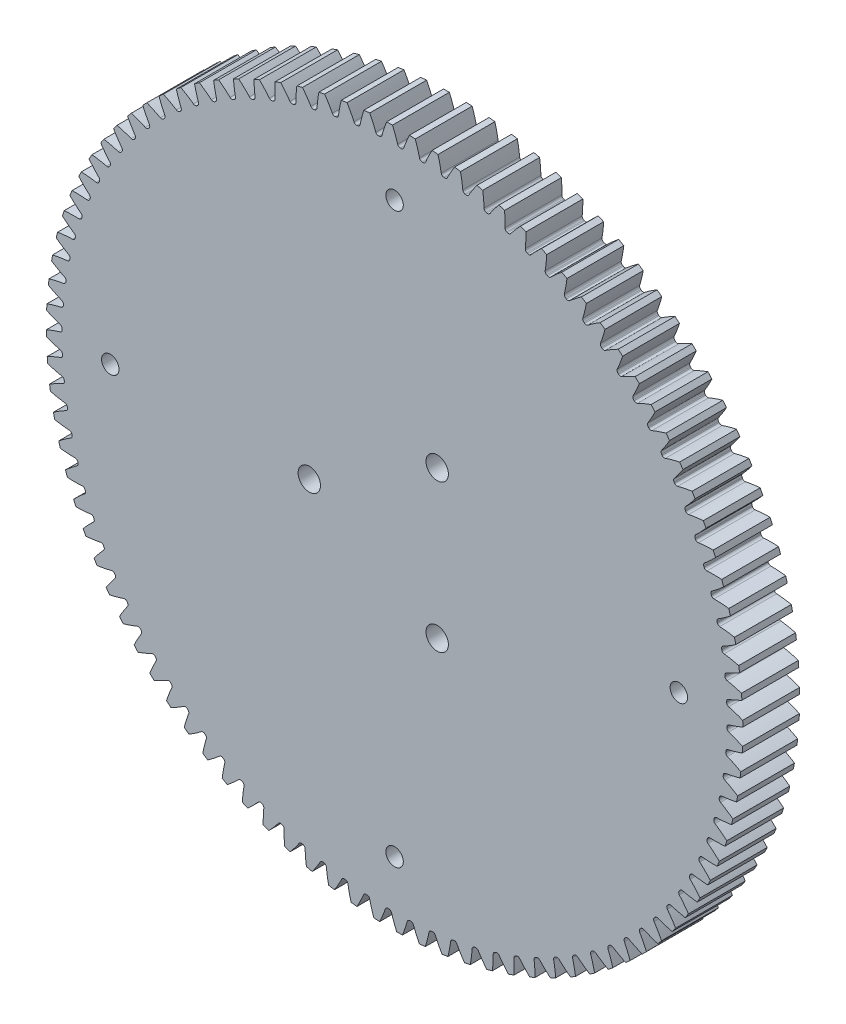
from build123d import *

# Parameters (mm, degrees)
SKETCH3_R          = 77.7875
GEARBODY_DEPTH     = 12.7
TOOTHCUT_DEPTH     = 111.738793169
CIRPATTERN1_COUNT  = 96
SKETCH4_R          = 2.499999953
CUT_EXTRUDE1_DEPTH = 111.736892249
SKETCH5_R          = 1.950000037
CUT_EXTRUDE2_DEPTH = 111.736892249


with BuildPart() as part:
    # Sketch3 → gearBody (new body)
    with BuildSketch(Plane.XY):
        Circle(SKETCH3_R)
    extrude(amount=GEARBODY_DEPTH)

    # Sketch2 → toothCut (cut, through all)
    with BuildSketch(Plane.XY):
        with BuildLine():
            ThreePointArc((74.229645105, -1.470041256), (74.231652244, -1.364931764), (74.233510549, -1.259819536))
            ThreePointArc((74.233510549, -1.259819536), (74.357469475, -0.900065574), (74.669516207, -0.682314421))
            ThreePointArc((74.669516207, -0.682314421), (83.521868489, 3.746156538), (90.39842703, 10.865737887))
            ThreePointArc((90.39842703, 10.865737887), (91.033719016, -1.673879146), (89.937868837, -14.181664866))
            ThreePointArc((89.937868837, -14.181664866), (83.327692223, -6.814096673), (74.644125506, -2.063184652))
            ThreePointArc((74.644125506, -2.063184652), (74.340294784, -1.834109074), (74.229645105, -1.470041256))
        make_face()
    toothcut = extrude(amount=TOOTHCUT_DEPTH, mode=Mode.SUBTRACT)

    # CirPattern1: toothCut ×96 about axis
    cirpattern1_axis = Axis((0, 0, 12.7), (0, 0, -1))
    for i in range(1, CIRPATTERN1_COUNT):
        add(toothcut.rotate(cirpattern1_axis, i * 360 / CIRPATTERN1_COUNT), mode=Mode.SUBTRACT)

    # Sketch4 → Cut-Extrude1 (cut, through all)
    with BuildSketch(Plane(origin=(0, 0, 0), x_dir=(-1, 0, 0), z_dir=(0, 0, -1))):
        with Locations((19.05, 0)):
            Circle(SKETCH4_R)
        with Locations((-9.525, -16.497783942)):
            Circle(SKETCH4_R)
        with Locations((-9.525, 16.497783942)):
            Circle(SKETCH4_R)
    extrude(amount=-CUT_EXTRUDE1_DEPTH, mode=Mode.SUBTRACT)

    # Sketch5 → Cut-Extrude2 (cut, through all)
    with BuildSketch(Plane(origin=(0, 0, 0), x_dir=(-1, 0, 0), z_dir=(0, 0, -1))):
        with Locations((63.5, 0)):
            Circle(SKETCH5_R)
        with Locations((0, -63.5)):
            Circle(SKETCH5_R)
        with Locations((-63.5, 0)):
            Circle(SKETCH5_R)
        with Locations((0, 63.5)):
            Circle(SKETCH5_R)
    extrude(amount=-CUT_EXTRUDE2_DEPTH, mode=Mode.SUBTRACT)


solid = part.part
